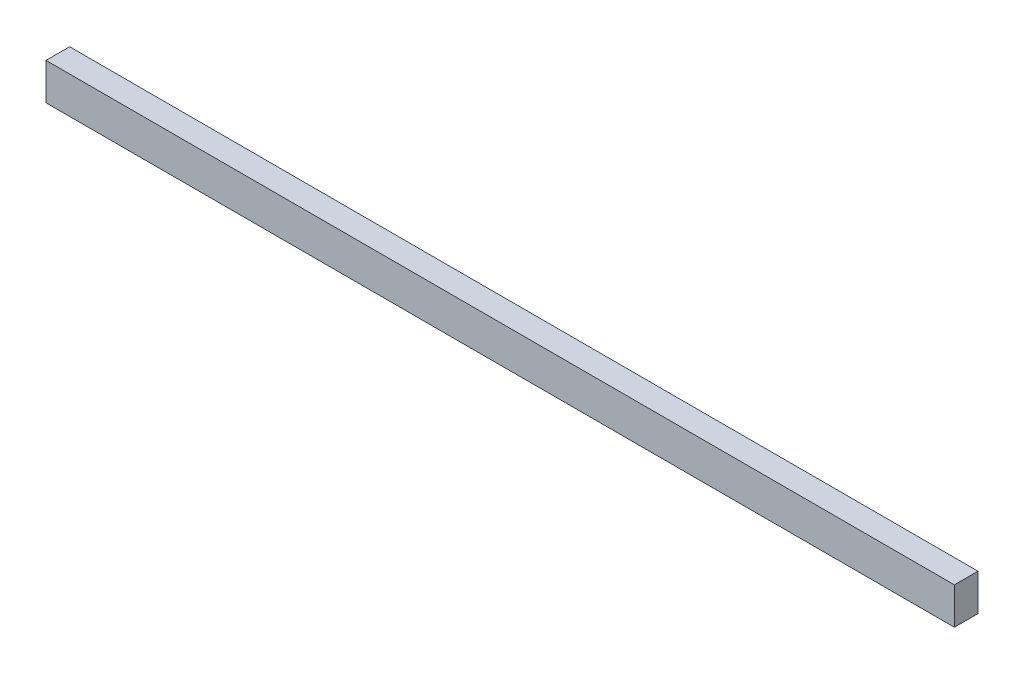
from build123d import *

# Parameters (mm, degrees)
SKETCH1_W           = 45
SKETCH1_H           = 70
BOSS_EXTRUDE1_DEPTH = 1730


with BuildPart() as part:
    # Sketch1 → Boss-Extrude1 (new body)
    with BuildSketch(Plane(origin=(0, 0, 0), x_dir=(0, 0, -1), z_dir=(1, 0, 0))):
        with Locations((22.5, 35)):
            Rectangle(SKETCH1_W, SKETCH1_H)
    extrude(amount=BOSS_EXTRUDE1_DEPTH)


solid = part.part
